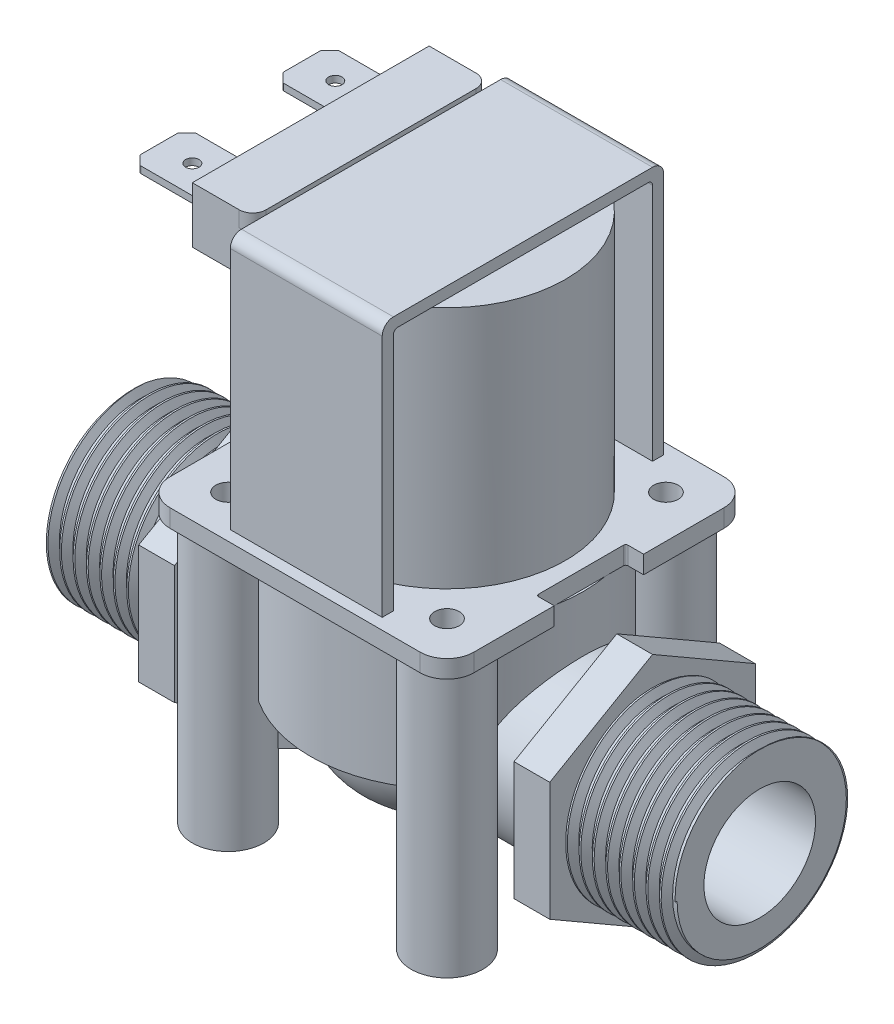
from build123d import *
from build123d.topology import SkipClean

# Parameters (mm, degrees)
SKETCH1_W                 = 34
SKETCH1_H                 = 34
SKETCH1_R                 = 1.375
BOSS_EXTRUDE1_DEPTH       = 2
FILLET1_R                 = 3
SKETCH2_W                 = 17
SKETCH2_H                 = 1.25
BOSS_EXTRUDE2_DEPTH       = 28.5
SKETCH3_W                 = 17
SKETCH3_H                 = 29
BOSS_EXTRUDE3_DEPTH       = 1.25
FILLET2_R                 = 1.25
FILLET3_R                 = 0.5
SKETCH4_R                 = 13.25
BOSS_EXTRUDE4_DEPTH       = 27.25
SKETCH5_W                 = 15.25
SKETCH5_H                 = 26.5
BOSS_EXTRUDE5_DEPTH       = 4.5
BOSS_EXTRUDE6_DEPTH       = 1.75
SKETCH7_W                 = 8
SKETCH7_H                 = 0.75
BOSS_EXTRUDE7_DEPTH       = 9
SKETCH8_W                 = 8
SKETCH8_H                 = 0.875
CUT_EXTRUDE1_DEPTH        = 0.75
CHAMFER1_SIZE             = 1
FILLET4_R                 = 0.25
SKETCH9_W                 = 2
SKETCH9_H                 = 10
CUT_EXTRUDE2_DEPTH        = 2
FILLET6_R                 = 0.25
SKETCH10_R                = 0.75
CUT_EXTRUDE3_DEPTH        = 0.75
BOSS_EXTRUDE8_START       = 30
SKETCH11_R                = 4
SKETCH11_R_2              = 1.375
BOSS_EXTRUDE8_DEPTH       = 30
BOSS_EXTRUDE9_DEPTH       = 22.5
SKETCH13_R                = 11.5
BOSS_EXTRUDE10_DEPTH      = 25
FILLET7_R                 = 7.5
SKETCH14_R                = 15.25
SKETCH14_R_2              = 14.25
BOSS_EXTRUDE14_DEPTH      = 16
BOSS_EXTRUDE15_DEPTH      = 16
BOSS_EXTRUDE16_DEPTH      = 18
BOSS_EXTRUDE16_DEPTH_BACK = 52
SKETCH15_R                = 9.25
SKETCH16_R                = 6.25
CUT_EXTRUDE4_DEPTH        = 70
THREAD1_PITCH             = 1.5
THREAD1_FROM              = 1
THREAD2_PITCH             = 1.5
THREAD2_FROM              = 1
BOSS_EXTRUDE18_START      = 2
BOSS_EXTRUDE18_DEPTH      = 4
BOSS_EXTRUDE19_START      = 2
BOSS_EXTRUDE19_DEPTH      = 4


with BuildPart() as part:
    # Sketch1 → Boss-Extrude1 (new body)
    with BuildSketch(Plane(origin=(0, 0, 0), x_dir=(1, 0, 0), z_dir=(0, 1, 0))):
        Rectangle(SKETCH1_W, SKETCH1_H)
        with Locations(Location((12.25, -12.25, 0), (0, 0, 270))):
            Circle(SKETCH1_R, mode=Mode.SUBTRACT)
        with Locations(Location((-12.25, -12.25, 0), (0, 0, 270))):
            Circle(SKETCH1_R, mode=Mode.SUBTRACT)
        with Locations(Location((12.25, 12.25, 0), (0, 0, 270))):
            Circle(SKETCH1_R, mode=Mode.SUBTRACT)
        with Locations(Location((-12.25, 12.25, 0), (0, 0, 270))):
            Circle(SKETCH1_R, mode=Mode.SUBTRACT)
    extrude(amount=BOSS_EXTRUDE1_DEPTH)

    # Fillet1
    fillet1_edges = [part.edges().sort_by_distance(p)[0] for p in [
        (17, 1, 17),
        (-17, 1, 17),
        (-17, 1, -17),
        (17, 1, -17),
    ]]
    fillet(fillet1_edges, radius=FILLET1_R)

    # Sketch2 → Boss-Extrude2 (add)
    with BuildSketch(Plane(origin=(0, 2, 0), x_dir=(1, 0, 0), z_dir=(0, 1, 0))):
        with Locations((0, -15.125)):
            Rectangle(SKETCH2_W, SKETCH2_H)
        with Locations((0, 15.125)):
            Rectangle(SKETCH2_W, SKETCH2_H)
    extrude(amount=BOSS_EXTRUDE2_DEPTH)

    # Sketch3 → Boss-Extrude3 (add)
    with BuildSketch(Plane(origin=(0, 30.5, 0), x_dir=(1, 0, 0), z_dir=(0, 1, 0))):
        Rectangle(SKETCH3_W, SKETCH3_H)
    extrude(amount=-BOSS_EXTRUDE3_DEPTH)

    # Fillet2
    fillet2_edges = [part.edges().sort_by_distance(p)[0] for p in [
        (0, 30.5, 15.75),
        (0, 30.5, -15.75),
    ]]
    fillet(fillet2_edges, radius=FILLET2_R)

    # Fillet3
    fillet3_edges = [part.edges().sort_by_distance(p)[0] for p in [
        (0, 29.25, -14.5),
        (0, 29.25, 14.5),
    ]]
    fillet(fillet3_edges, radius=FILLET3_R)

    # Sketch4 → Boss-Extrude4 (add)
    with BuildSketch(Plane(origin=(0, 2, 0), x_dir=(1, 0, 0), z_dir=(0, 1, 0))):
        with Locations(Location((0, 0, 0), (0, 0, 129.904466491))):
            Circle(SKETCH4_R)
    extrude(amount=BOSS_EXTRUDE4_DEPTH)

    # Sketch5 → Boss-Extrude5 (add)
    with BuildSketch(Plane(origin=(0, 29.25, 0), x_dir=(1, 0, 0), z_dir=(0, 1, 0))):
        with Locations((-7.625, 0)):
            Rectangle(SKETCH5_W, SKETCH5_H)
    extrude(amount=-BOSS_EXTRUDE5_DEPTH)

    # Sketch6 → Boss-Extrude6 (add)
    with BuildSketch(Plane(origin=(0, 29.25, 0), x_dir=(1, 0, 0), z_dir=(0, 1, 0))):
        with BuildLine():
            Line((-15.25, 13.25), (-10, 13.25))
            ThreePointArc((-10, 13.25), (-8.939339828, 12.810660172), (-8.5, 11.75))
            Line((-8.5, 11.75), (-8.5, -11.75))
            ThreePointArc((-8.5, -11.75), (-8.939339828, -12.810660172), (-10, -13.25))
            Line((-10, -13.25), (-15.25, -13.25))
            Line((-15.25, -13.25), (-15.25, 13.25))
        make_face()
    extrude(amount=BOSS_EXTRUDE6_DEPTH)

    # Sketch7 → Boss-Extrude7 (add)
    with BuildSketch(Plane.ZY.offset(15.25)):
        with Locations((-8, 27.25)):
            Rectangle(SKETCH7_W, SKETCH7_H)
        with Locations((8, 27.25)):
            Rectangle(SKETCH7_W, SKETCH7_H)
    extrude(amount=BOSS_EXTRUDE7_DEPTH)

    # Sketch8 → Cut-Extrude1 (cut)
    with BuildSketch(Plane(origin=(0, 27.625, 0), x_dir=(1, 0, 0), z_dir=(0, 1, 0))):
        with Locations((-20.25, -4.4375)):
            Rectangle(SKETCH8_W, SKETCH8_H)
        with Locations((-20.25, 11.5625)):
            Rectangle(SKETCH8_W, SKETCH8_H)
        with Locations((-20.25, 4.4375)):
            Rectangle(SKETCH8_W, SKETCH8_H)
        with Locations((-20.25, -11.5625)):
            Rectangle(SKETCH8_W, SKETCH8_H)
    extrude(amount=-CUT_EXTRUDE1_DEPTH, mode=Mode.SUBTRACT)

    # Chamfer1
    chamfer1_edges = [part.edges().sort_by_distance(p)[0] for p in [
        (-24.25, 27.25, -11.125),
        (-24.25, 27.25, -4.875),
        (-24.25, 27.25, 4.875),
        (-24.25, 27.25, 11.125),
    ]]
    chamfer(chamfer1_edges, length=CHAMFER1_SIZE)

    # Fillet4
    fillet4_edges = [part.edges().sort_by_distance(p)[0] for p in [
        (-24.25, 27.25, 5.875),
        (-24.25, 27.25, 10.125),
        (-23.25, 27.25, 11.125),
        (-23.25, 27.25, 4.875),
        (-24.25, 27.25, -10.125),
        (-24.25, 27.25, -5.875),
        (-23.25, 27.25, -4.875),
        (-23.25, 27.25, -11.125),
    ]]
    fillet(fillet4_edges, radius=FILLET4_R)

    # Sketch9 → Cut-Extrude2 (cut)
    with BuildSketch(Plane.XZ):
        with Locations((-16, 0)):
            Rectangle(SKETCH9_W, SKETCH9_H)
        with Locations((16, 0)):
            Rectangle(SKETCH9_W, SKETCH9_H)
    extrude(amount=-CUT_EXTRUDE2_DEPTH, mode=Mode.SUBTRACT)

    # Fillet6
    fillet6_edges = [part.edges().sort_by_distance(p)[0] for p in [
        (-15, 1, 5),
        (-15, 1, -5),
        (15, 1, 5),
        (15, 1, -5),
    ]]
    fillet(fillet6_edges, radius=FILLET6_R)

    # Sketch10 → Cut-Extrude3 (cut)
    with BuildSketch(Plane(origin=(0, 27.625, 0), x_dir=(1, 0, 0), z_dir=(0, 1, 0))):
        with Locations(Location((-20.5, 8, 0), (0, 0, 270))):
            Circle(SKETCH10_R)
        with Locations(Location((-20.5, -8, 0), (0, 0, 270))):
            Circle(SKETCH10_R)
    extrude(amount=-CUT_EXTRUDE3_DEPTH, mode=Mode.SUBTRACT)

    # Sketch11 → Boss-Extrude8 (add)
    # profile 1 of 4: a face of its own
    with SkipClean():  # the faces are left unmerged after this step: merging them gives an invalid solid
        with BuildSketch(Plane.XZ.offset(BOSS_EXTRUDE8_START)):
            with Locations(Location((12.25, 12.25, 0), (0, 0, 90))):
                Circle(SKETCH11_R)
            with Locations(Location((12.25, 12.25, 0), (0, 0, 270))):
                Circle(SKETCH11_R_2, mode=Mode.SUBTRACT)
        # profile 2 of 4: a face of its own
        with BuildSketch(Plane.XZ.offset(BOSS_EXTRUDE8_START)):
            with Locations(Location((-12.25, 12.25, 0), (0, 0, 270))):
                Circle(SKETCH11_R)
            with Locations(Location((-12.25, 12.25, 0), (0, 0, 270))):
                Circle(SKETCH11_R_2, mode=Mode.SUBTRACT)
        # profile 3 of 4: a face of its own
        with BuildSketch(Plane.XZ.offset(BOSS_EXTRUDE8_START)):
            with Locations(Location((12.25, -12.25, 0), (0, 0, 270))):
                Circle(SKETCH11_R)
            with Locations(Location((12.25, -12.25, 0), (0, 0, 270))):
                Circle(SKETCH11_R_2, mode=Mode.SUBTRACT)
        # profile 4 of 4: a face of its own
        with BuildSketch(Plane.XZ.offset(BOSS_EXTRUDE8_START)):
            with Locations(Location((-12.25, -12.25, 0), (0, 0, 90))):
                Circle(SKETCH11_R)
            with Locations(Location((-12.25, -12.25, 0), (0, 0, 270))):
                Circle(SKETCH11_R_2, mode=Mode.SUBTRACT)
        extrude(amount=-BOSS_EXTRUDE8_DEPTH)

    # Sketch12 → Boss-Extrude9 (add)
    with SkipClean():  # the faces are left unmerged after this step: merging them gives an invalid solid
        with BuildSketch(Plane.XZ):
            Polygon((10.603553391, 9.896446609), (9.896446609, 10.603553391), (0, 0.707106781), (-9.896446609, 10.603553391), (-10.603553391, 9.896446609), (-0.707106781, 0), (-10.603553391, -9.896446609), (-9.896446609, -10.603553391), (0, -0.707106781), (9.896446609, -10.603553391), (10.603553391, -9.896446609), (0.707106781, 0), align=None)
        extrude(amount=BOSS_EXTRUDE9_DEPTH)

    # Sketch13 → Boss-Extrude10 (add)
    with SkipClean():  # the faces are left unmerged after this step: merging them gives an invalid solid
        with BuildSketch(Plane.XZ):
            with Locations(Location((0, 0, 0), (0, 0, 47.491906369))):
                Circle(SKETCH13_R)
        extrude(amount=BOSS_EXTRUDE10_DEPTH)

    # Fillet7
    # the kernel refuses this fillet: 7.5 mm, written as the material it takes off along each edge
    with BuildSketch(Plane(origin=(0, -25, 0), x_dir=(0.6756943490469315, 0, 0.7371818952375618), z_dir=(0.7371818952375618, 0, -0.6756943490469315))) as fillet7_piece_1_section:
        with BuildLine():
            CenterArc((11.5 - FILLET7_R, -FILLET7_R), FILLET7_R, 0, 90)
            Line((11.5 - FILLET7_R, 0), (11.5, 0))
            Line((11.5, 0), (11.5, -FILLET7_R))
        make_face()
    fillet7_piece_1 = revolve(axis=Axis((0, -25, 0), (0, -1, 0)), mode=Mode.PRIVATE)
    fillet7_piece_1 = split(fillet7_piece_1, bisect_by=Plane(origin=(0.353553391, -25, 0.353553391), z_dir=(0.7071067811865476, 0, 0.7071067811865475)), keep=Keep.TOP, mode=Mode.PRIVATE)
    fillet7_piece_1 = split(fillet7_piece_1, bisect_by=Plane(origin=(-0.353553391, -25, 0.353553391), z_dir=(-0.7071067811865476, 0, 0.7071067811865475)), keep=Keep.TOP, mode=Mode.PRIVATE)
    add(fillet7_piece_1, mode=Mode.SUBTRACT)
    with BuildSketch(Plane(origin=(0, -25, 0), x_dir=(0.6756943490469315, 0, 0.7371818952375618), z_dir=(0.7371818952375618, 0, -0.6756943490469315))) as fillet7_piece_2_section:
        with BuildLine():
            CenterArc((11.5 - FILLET7_R, -FILLET7_R), FILLET7_R, 0, 90)
            Line((11.5 - FILLET7_R, 0), (11.5, 0))
            Line((11.5, 0), (11.5, -FILLET7_R))
        make_face()
    fillet7_piece_2 = revolve(axis=Axis((0, -25, 0), (0, -1, 0)), mode=Mode.PRIVATE)
    fillet7_piece_2 = split(fillet7_piece_2, bisect_by=Plane(origin=(0, -22.5, 0), z_dir=(0, -1, 0)), keep=Keep.TOP, mode=Mode.PRIVATE)
    add(fillet7_piece_2, mode=Mode.SUBTRACT)
    with BuildSketch(Plane(origin=(0, -25, 0), x_dir=(0.6756943490469315, 0, 0.7371818952375618), z_dir=(0.7371818952375618, 0, -0.6756943490469315))) as fillet7_piece_3_section:
        with BuildLine():
            CenterArc((11.5 - FILLET7_R, -FILLET7_R), FILLET7_R, 0, 90)
            Line((11.5 - FILLET7_R, 0), (11.5, 0))
            Line((11.5, 0), (11.5, -FILLET7_R))
        make_face()
    fillet7_piece_3 = revolve(axis=Axis((0, -25, 0), (0, -1, 0)), mode=Mode.PRIVATE)
    fillet7_piece_3 = split(fillet7_piece_3, bisect_by=Plane(origin=(-0.353553391, -25, 0.353553391), z_dir=(-0.7071067811865476, 0, 0.7071067811865475)), keep=Keep.TOP, mode=Mode.PRIVATE)
    fillet7_piece_3 = split(fillet7_piece_3, bisect_by=Plane(origin=(-0.353553391, -25, -0.353553391), z_dir=(-0.7071067811865478, 0, -0.7071067811865472)), keep=Keep.TOP, mode=Mode.PRIVATE)
    add(fillet7_piece_3, mode=Mode.SUBTRACT)
    with BuildSketch(Plane(origin=(0, -25, 0), x_dir=(0.6756943490469315, 0, 0.7371818952375618), z_dir=(0.7371818952375618, 0, -0.6756943490469315))) as fillet7_piece_4_section:
        with BuildLine():
            CenterArc((11.5 - FILLET7_R, -FILLET7_R), FILLET7_R, 0, 90)
            Line((11.5 - FILLET7_R, 0), (11.5, 0))
            Line((11.5, 0), (11.5, -FILLET7_R))
        make_face()
    fillet7_piece_4 = revolve(axis=Axis((0, -25, 0), (0, -1, 0)), mode=Mode.PRIVATE)
    fillet7_piece_4 = split(fillet7_piece_4, bisect_by=Plane(origin=(0.353553391, -25, 0.353553391), z_dir=(0.7071067811865476, 0, 0.7071067811865475)), keep=Keep.TOP, mode=Mode.PRIVATE)
    fillet7_piece_4 = split(fillet7_piece_4, bisect_by=Plane(origin=(0.353553391, -25, -0.353553391), z_dir=(0.7071067811865476, 0, -0.7071067811865476)), keep=Keep.TOP, mode=Mode.PRIVATE)
    add(fillet7_piece_4, mode=Mode.SUBTRACT)
    with BuildSketch(Plane(origin=(0, -25, 0), x_dir=(0.6756943490469315, 0, 0.7371818952375618), z_dir=(0.7371818952375618, 0, -0.6756943490469315))) as fillet7_piece_5_section:
        with BuildLine():
            CenterArc((11.5 - FILLET7_R, -FILLET7_R), FILLET7_R, 0, 90)
            Line((11.5 - FILLET7_R, 0), (11.5, 0))
            Line((11.5, 0), (11.5, -FILLET7_R))
        make_face()
    fillet7_piece_5 = revolve(axis=Axis((0, -25, 0), (0, -1, 0)), mode=Mode.PRIVATE)
    fillet7_piece_5 = split(fillet7_piece_5, bisect_by=Plane(origin=(0.353553391, -25, -0.353553391), z_dir=(0.7071067811865476, 0, -0.7071067811865476)), keep=Keep.TOP, mode=Mode.PRIVATE)
    fillet7_piece_5 = split(fillet7_piece_5, bisect_by=Plane(origin=(-0.353553391, -25, -0.353553391), z_dir=(-0.7071067811865478, 0, -0.7071067811865472)), keep=Keep.TOP, mode=Mode.PRIVATE)
    add(fillet7_piece_5, mode=Mode.SUBTRACT)

    # Sketch14 → Boss-Extrude14 (add)
    with BuildSketch(Plane.XZ):
        Circle(SKETCH14_R)
        Circle(SKETCH14_R_2, mode=Mode.SUBTRACT)
    extrude(amount=BOSS_EXTRUDE14_DEPTH)

    # Sketch14<3> → Boss-Extrude15 (add)
    with BuildSketch(Plane.XZ):
        with BuildLine():
            ThreePointArc((-14.241225369, 0.5), (-14.25, 0), (-14.241225369, -0.5))
            Line((-14.241225369, -0.5), (-11.489125293, -0.5))
            ThreePointArc((-11.489125293, -0.5), (-11.5, 0), (-11.489125293, 0.5))
            Line((-11.489125293, 0.5), (-14.241225369, 0.5))
        make_face()
        with BuildLine():
            Line((-0.5, -11.489125293), (-0.5, -14.241225369))
            ThreePointArc((-0.5, -14.241225369), (0, -14.25), (0.5, -14.241225369))
            Line((0.5, -14.241225369), (0.5, -11.489125293))
            Line((0.5, -11.489125293), (-0.5, -11.489125293))
        make_face()
        with BuildLine():
            ThreePointArc((0.5, 14.241225369), (0, 14.25), (-0.5, 14.241225369))
            Line((-0.5, 14.241225369), (-0.5, 11.489125293))
            Line((-0.5, 11.489125293), (0.5, 11.489125293))
            Line((0.5, 11.489125293), (0.5, 14.241225369))
        make_face()
        with BuildLine():
            Line((11.489125293, -0.5), (14.241225369, -0.5))
            ThreePointArc((14.241225369, -0.5), (14.25, 0), (14.241225369, 0.5))
            Line((14.241225369, 0.5), (11.489125293, 0.5))
            Line((11.489125293, 0.5), (11.489125293, -0.5))
        make_face()
    extrude(amount=BOSS_EXTRUDE15_DEPTH)

    # Sketch15 → Boss-Extrude16 (add, two sides: drawn at the far end of the back side and taken through both)
    with BuildSketch(Plane.ZY.offset(17).offset(-BOSS_EXTRUDE16_DEPTH_BACK)):
        with Locations((0, -15.5)):
            Circle(SKETCH15_R)
    extrude(amount=BOSS_EXTRUDE16_DEPTH + BOSS_EXTRUDE16_DEPTH_BACK)

    # Sketch16 → Cut-Extrude4 (cut)
    with BuildSketch(Plane(origin=(35, 0, 0), x_dir=(0, 0, -1), z_dir=(1, 0, 0))):
        with Locations((0, -15.5)):
            Circle(SKETCH16_R)
    extrude(amount=-CUT_EXTRUDE4_DEPTH, mode=Mode.SUBTRACT)

    # Thread1: arcs per turn and ends read off the stored shape
    # Thread1: the profile of Thread Profile1 profile screwed along a right-hand helix through 9 turns, 8 arcs to a turn; built about Z, then put on its axis
    thread1_z = Axis((0, 0, 0), (0, 0, 1))
    thread1_corners = [(9.2497, 0, -0.000173205), (10.061898813, 0, 0.468749998), (10.061898813, 0, 0.656249998), (9.2497, 0, 1.125173201)]
    with BuildLine(mode=Mode.PRIVATE) as thread1_profile:
        Line(thread1_corners[0], thread1_corners[1])
        Line(thread1_corners[1], thread1_corners[2])
        Line(thread1_corners[2], thread1_corners[3])
        Line(thread1_corners[3], thread1_corners[0])
    thread1_cap = Face(thread1_profile.wire())
    thread1_turn_angles = [0, 22.5, 45, 67.5, 90, 112.5, 135, 157.5, 180, 202.5, 225, 247.5, 270, 292.5, 315, 337.5, 360]
    thread1_turn_weights = [1, 0.9238795325112867, 1, 0.9238795325112867, 1, 0.9238795325112867, 1, 0.9238795325112867, 1, 0.9238795325112867, 1, 0.9238795325112867, 1, 0.9238795325112867, 1, 0.9238795325112867, 1]
    thread1_turn_rails = [Edge.make_bspline([Vector(p[0], p[1], 0).rotate(thread1_z, thread1_turn_angles[k]) / thread1_turn_weights[k] + Vector(0, 0, p[2] + THREAD1_PITCH * thread1_turn_angles[k] / 360) for k in range(17)], [0, 0, 0, 1, 1, 2, 2, 3, 3, 4, 4, 5, 5, 6, 6, 7, 7, 8, 8, 8], 2, thread1_turn_weights) for p in thread1_corners]
    thread1_turn_sides = [Face.make_surface_from_curves(thread1_turn_rails[p[0]], thread1_turn_rails[p[1]]) for p in [(0, 1), (1, 2), (2, 3), (3, 0)]]
    thread1 = Plane(origin=(-36, -15.5, 0), x_dir=(0, 0, -1), z_dir=(1, 0, 0)) * split(Solid(Shell([*[p.moved(Location((0, 0, THREAD1_PITCH * i))) for i in range(9) for p in thread1_turn_sides], thread1_cap, thread1_cap.rotate(thread1_z, 3240).moved(Location((0, 0, THREAD1_PITCH * 3240 / 360)))])), bisect_by=Plane.XY.offset(THREAD1_FROM), keep=Keep.TOP, mode=Mode.PRIVATE)
    add(thread1)

    # Thread2: arcs per turn and ends read off the stored shape
    # Thread2: the profile of Thread Profile2 profile screwed along a right-hand helix through 9 turns, 8 arcs to a turn; built about Z, then put on its axis
    thread2_z = Axis((0, 0, 0), (0, 0, 1))
    thread2_corners = [(9.2497, 0, -0.000173205), (10.061898813, 0, 0.468749998), (10.061898813, 0, 0.656249998), (9.2497, 0, 1.125173201)]
    with BuildLine(mode=Mode.PRIVATE) as thread2_profile:
        Line(thread2_corners[0], thread2_corners[1])
        Line(thread2_corners[1], thread2_corners[2])
        Line(thread2_corners[2], thread2_corners[3])
        Line(thread2_corners[3], thread2_corners[0])
    thread2_cap = Face(thread2_profile.wire())
    thread2_turn_angles = [0, 22.5, 45, 67.5, 90, 112.5, 135, 157.5, 180, 202.5, 225, 247.5, 270, 292.5, 315, 337.5, 360]
    thread2_turn_weights = [1, 0.9238795325112867, 1, 0.9238795325112867, 1, 0.9238795325112867, 1, 0.9238795325112867, 1, 0.9238795325112867, 1, 0.9238795325112867, 1, 0.9238795325112867, 1, 0.9238795325112867, 1]
    thread2_turn_rails = [Edge.make_bspline([Vector(p[0], p[1], 0).rotate(thread2_z, thread2_turn_angles[k]) / thread2_turn_weights[k] + Vector(0, 0, p[2] + THREAD2_PITCH * thread2_turn_angles[k] / 360) for k in range(17)], [0, 0, 0, 1, 1, 2, 2, 3, 3, 4, 4, 5, 5, 6, 6, 7, 7, 8, 8, 8], 2, thread2_turn_weights) for p in thread2_corners]
    thread2_turn_sides = [Face.make_surface_from_curves(thread2_turn_rails[p[0]], thread2_turn_rails[p[1]]) for p in [(0, 1), (1, 2), (2, 3), (3, 0)]]
    thread2 = Plane(origin=(36, -15.5, 0), x_dir=(0, 0, 1), z_dir=(-1, 0, 0)) * split(Solid(Shell([*[p.moved(Location((0, 0, THREAD2_PITCH * i))) for i in range(9) for p in thread2_turn_sides], thread2_cap, thread2_cap.rotate(thread2_z, 3240).moved(Location((0, 0, THREAD2_PITCH * 3240 / 360)))])), bisect_by=Plane.XY.offset(THREAD2_FROM), keep=Keep.TOP, mode=Mode.PRIVATE)
    add(thread2)

    # Sketch23 → Boss-Extrude18 (add)
    with BuildSketch(Plane.ZY.offset(17).offset(BOSS_EXTRUDE18_START)):
        Polygon((11.5, -15.5), (-11.5, -15.5), (-11.5, -22.139528096), (0, -28.779056191), (11.5, -22.139528096), align=None)
        Polygon((-11.5, -8.860471904), (-11.5, -15.5), (11.5, -15.5), (11.5, -8.860471904), (0, -2.220943809), align=None)
    extrude(amount=BOSS_EXTRUDE18_DEPTH)

    # Sketch25 → Boss-Extrude19 (add)
    with BuildSketch(Plane(origin=(17, 0, 0), x_dir=(0, 0, -1), z_dir=(1, 0, 0)).offset(BOSS_EXTRUDE19_START)):
        Polygon((11.5, -15.5), (-11.5, -15.5), (-11.5, -22.139528096), (0, -28.779056191), (11.5, -22.139528096), align=None)
        Polygon((-11.5, -8.860471904), (-11.5, -15.5), (11.5, -15.5), (11.5, -8.860471904), (0, -2.220943809), align=None)
    extrude(amount=BOSS_EXTRUDE19_DEPTH)


solid = part.part
